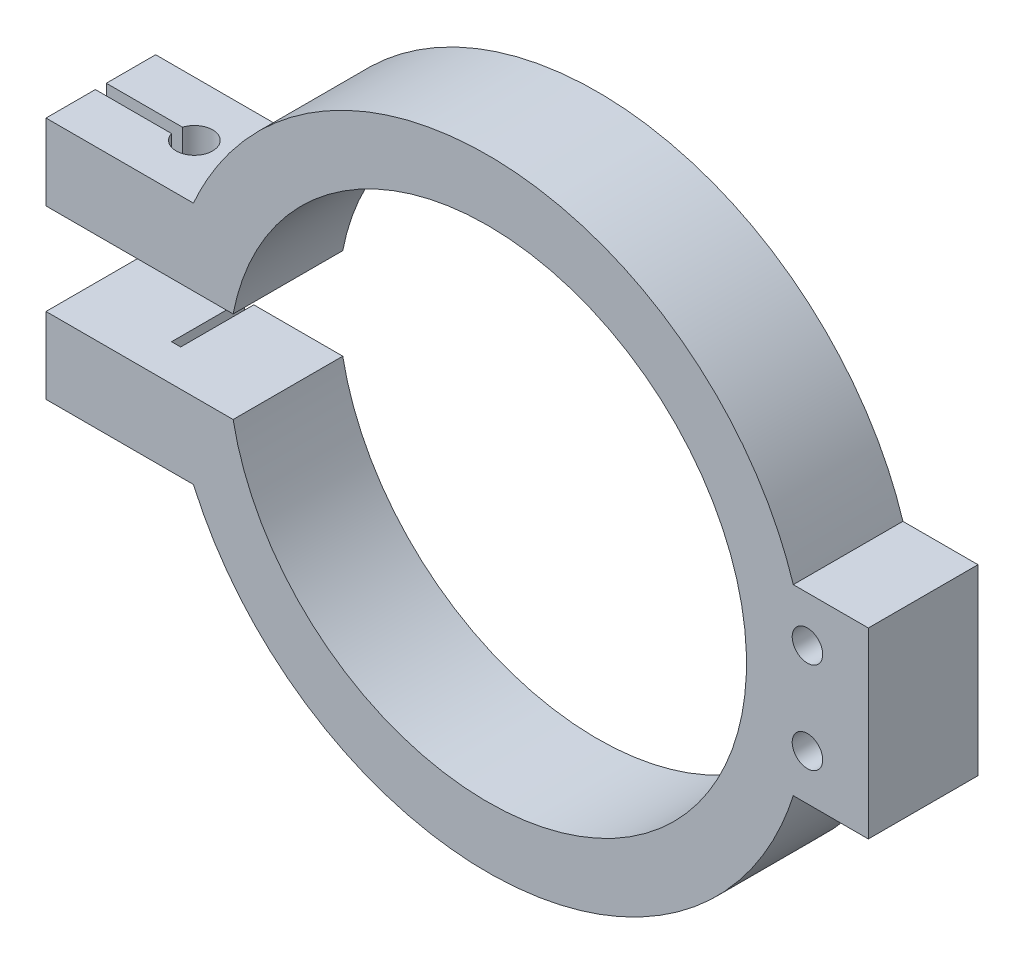
from build123d import *

# Parameters (mm, degrees)
BOSS_EXTRU_2_OUTLINE_R  = 2.5
BOSS_EXTRU_2_DEPTH      = 18
ENL_V_MAT_EXTRU_1_DEPTH = 12
ENL_V_MAT_EXTRU_2_DEPTH = 6
ENL_V_MAT_EXTRU_3_REACH = 101.021


# Read off the part's stored shape, not the designer's step: Boss.-Extru.2
with BuildPart() as part:
    # Boss.-Extru.2 outline → Boss.-Extru.2 (new body)
    with BuildSketch(Plane.XY):
        with BuildLine():
            Line((62.5, -15), (62.5, 15))
            Line((62.5, 15), (50.175927058, 15))
            add(Edge.make_bspline(
                [(50.175927058, 15), (49.67909986, 16.571798852), (46.757495283, 24.440449194), (37.942672272, 37.144571389), (20.476388489, 48.384624843), (0, 52.307687579), (-20.476388489, 48.384624843), (-37.828180297, 37.218250251), (-45.641211898, 26.048364042), (-48.295419771, 20.000000003)],
                knots=[3.438135888, 3.438135888, 3.438135888, 3.438135888, 3.534291735, 3.926990817, 4.319689899, 4.71238898, 5.105088062, 5.497787144, 5.882763765, 5.882763765, 5.882763765, 5.882763765], degree=3))
            Line((-48.295419771, 20.000000003), (-72.5, 20))
            Line((-72.5, 20), (-72.5, 7.5))
            Line((-72.5, 7.5), (-41.78287755, 7.5))
            add(Edge.make_bspline(
                [(-41.78287755, -7.5), (-30.043034366, -68.368028027), (23.465627489, -34.184014013), (76.974289344, 0), (23.465627489, 34.184014013), (-30.043034366, 68.368028027), (-41.78287755, 7.5)],
                knots=[0.183962694, 0.183962694, 0.183962694, 2.155716, 2.155716, 4.127469307, 4.127469307, 6.099222613, 6.099222613, 6.099222613], degree=2, weights=[1, 0.552132412, 1, 0.552132412, 1, 0.552132412, 1]))
            Line((-41.78287755, -7.5), (-72.5, -7.5))
            Line((-72.5, -7.5), (-72.5, -20))
            Line((-72.5, -20), (-48.295419771, -20.000000003))
            add(Edge.make_bspline(
                [(-48.295419771, -20.000000003), (-45.641211898, -26.048364042), (-37.828180297, -37.218250251), (-20.476388489, -48.384624843), (0, -52.307687579), (20.476388489, -48.384624843), (37.942672272, -37.144571389), (46.757495283, -24.440449194), (49.67909986, -16.571798852), (50.175927058, -15)],
                knots=[0.400421542, 0.400421542, 0.400421542, 0.400421542, 0.785398163, 1.178097245, 1.570796327, 1.963495408, 2.35619449, 2.748893572, 2.845049419, 2.845049419, 2.845049419, 2.845049419], degree=3))
            Line((50.175927058, -15), (62.5, -15))
        make_face()
        with Locations((52.5, -7.5)):
            Circle(BOSS_EXTRU_2_OUTLINE_R, mode=Mode.SUBTRACT)
        with Locations((52.5, 7.5)):
            Circle(BOSS_EXTRU_2_OUTLINE_R, mode=Mode.SUBTRACT)
    extrude(amount=BOSS_EXTRU_2_DEPTH)

    # Esquisse2 → Enlèv. mat.-Extru.1 (cut)
    with BuildSketch(Plane(origin=(0, 0, 0), x_dir=(-1, 0, 0), z_dir=(0, 0, -1))):
        with BuildLine():
            ThreePointArc((57.891438775, -10.84526249), (57.141438775, -10.75), (56.391438775, -10.84526249))
            Line((56.391438775, -10.84526249), (56.391438775, -13.75))
            Line((56.391438775, -13.75), (57.891438775, -13.75))
            Line((57.891438775, -13.75), (57.891438775, -10.84526249))
        make_face()
        with BuildLine():
            Line((56.391438775, -13.75), (56.391438775, -10.84526249))
            ThreePointArc((56.391438775, -10.84526249), (55.304321468, -16.121708245), (60.141438775, -13.75))
            ThreePointArc((60.141438775, -13.75), (59.51314702, -11.912882693), (57.891438775, -10.84526249))
            Line((57.891438775, -10.84526249), (57.891438775, -13.75))
            Line((57.891438775, -13.75), (56.391438775, -13.75))
        make_face()
        with BuildLine():
            Line((57.891438775, -7.5), (56.391438775, -7.5))
            Line((56.391438775, -7.5), (56.391438775, -10.84526249))
            ThreePointArc((56.391438775, -10.84526249), (57.141438775, -10.75), (57.891438775, -10.84526249))
            Line((57.891438775, -10.84526249), (57.891438775, -7.5))
        make_face()
    extrude(amount=-ENL_V_MAT_EXTRU_1_DEPTH, mode=Mode.SUBTRACT)

    # Esquisse3 → Enlèv. mat.-Extru.2 (cut)
    with BuildSketch(Plane(origin=(0, 20, 0), x_dir=(1, 0, 0), z_dir=(0, 1, 0))):
        with BuildLine():
            Line((-58.677294897, -9.9), (-59.729774883, -10.516745262))
            ThreePointArc((-59.729774883, -10.516745262), (-56.355629741, -11.895255457), (-54.141438775, -9))
            ThreePointArc((-54.141438775, -9), (-54.246183318, -8.214190966), (-54.553102667, -7.483254738))
            Line((-54.553102667, -7.483254738), (-57.5, -9.210114149))
            Line((-57.5, -9.210114149), (-57.5, -9.9))
            Line((-57.5, -9.9), (-58.677294897, -9.9))
        make_face()
        with BuildLine():
            Line((-57.5, -8.1), (-57.5, -9.210114149))
            Line((-57.5, -9.210114149), (-54.553102667, -7.483254738))
            ThreePointArc((-54.553102667, -7.483254738), (-57.478769046, -6.019025614), (-60.003256379, -8.1))
            Line((-60.003256379, -8.1), (-57.5, -8.1))
        make_face()
        Polygon((-57.5, -9.210114149), (-58.677294897, -9.9), (-57.5, -9.9), align=None)
        with BuildLine():
            Line((-60.003256379, -9.9), (-58.677294897, -9.9))
            Line((-58.677294897, -9.9), (-57.5, -9.210114149))
            Line((-57.5, -9.210114149), (-57.5, -8.1))
            Line((-57.5, -8.1), (-60.003256379, -8.1))
            ThreePointArc((-60.003256379, -8.1), (-60.141438775, -9), (-60.003256379, -9.9))
        make_face()
        with BuildLine():
            ThreePointArc((-60.003256379, -9.9), (-59.883908018, -10.216084885), (-59.729774883, -10.516745262))
            Line((-59.729774883, -10.516745262), (-58.677294897, -9.9))
            Line((-58.677294897, -9.9), (-60.003256379, -9.9))
        make_face()
        with BuildLine():
            Line((-72.5, -8.1), (-72.5, -9.9))
            Line((-72.5, -9.9), (-60.003256379, -9.9))
            ThreePointArc((-60.003256379, -9.9), (-60.141438775, -9), (-60.003256379, -8.1))
            Line((-60.003256379, -8.1), (-72.5, -8.1))
        make_face()
    extrude(amount=-ENL_V_MAT_EXTRU_2_DEPTH, mode=Mode.SUBTRACT)

    # Esquisse4 → Enlèv. mat.-Extru.3 (cut, up to next)
    with BuildSketch(Plane(origin=(0, 14, 0), x_dir=(1, 0, 0), z_dir=(0, 1, 0)), mode=Mode.PRIVATE) as enl_v_mat_extru_3_sk1:
        with BuildLine():
            Line((-72.5, -8.1), (-72.5, -9.9))
            Line((-72.5, -9.9), (-57.577328669, -9.9))
            ThreePointArc((-57.577328669, -9.9), (-56.141438775, -9), (-57.577328669, -8.1))
            Line((-57.577328669, -8.1), (-72.5, -8.1))
        make_face()
    enl_v_mat_extru_3_tool1 = extrude(enl_v_mat_extru_3_sk1.sketch, amount=-ENL_V_MAT_EXTRU_3_REACH, mode=Mode.PRIVATE) & part.part
    add(enl_v_mat_extru_3_tool1.solids().sort_by_distance((-64.370827, 14, 9))[0], mode=Mode.SUBTRACT)


solid = part.part
